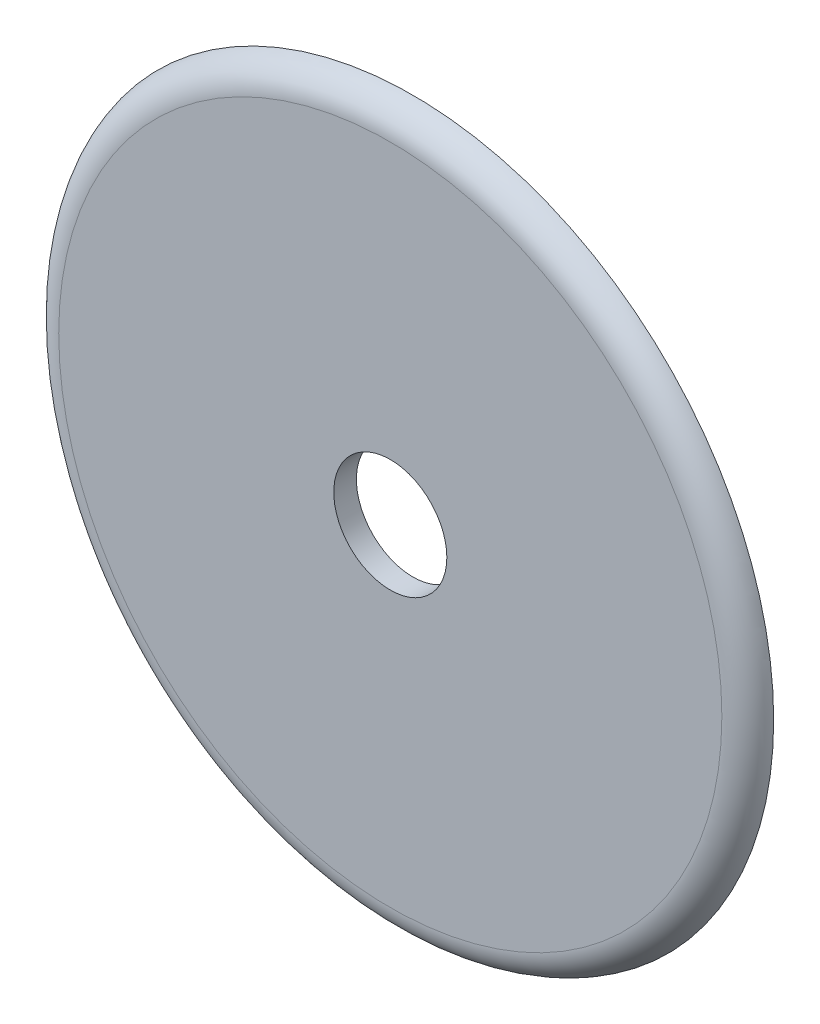
from build123d import *

# Parameters (mm, degrees)
SKETCH1_R           = 47.85
BOSS_EXTRUDE1_DEPTH = 3
SKETCH2_R           = 7.5
CUT_EXTRUDE1_DEPTH  = 6
FILLET2_R           = 4


with BuildPart() as part:
    # Sketch1 → Boss-Extrude1 (new body)
    with BuildSketch(Plane.XY):
        Circle(SKETCH1_R)
    extrude(amount=BOSS_EXTRUDE1_DEPTH)

    # Sketch2 → Cut-Extrude1 (cut)
    with BuildSketch(Plane.XY.offset(3)):
        Circle(SKETCH2_R)
    extrude(amount=-CUT_EXTRUDE1_DEPTH, mode=Mode.SUBTRACT)

    # Fillet2
    # the kernel refuses this fillet: 4 mm, written as the material it takes off along each edge
    with BuildSketch(Plane(origin=(0, 0, 3), x_dir=(1, 0, 0), z_dir=(0, -1, 0))) as fillet2_piece_1:
        with BuildLine():
            CenterArc((43.977016654, -4), FILLET2_R, 14.477512186, 75.522487814)
            Line((43.977016654, 0), (43.977016654, 0.08))
            Line((43.977016654, 0.08), (47.85, 0.08))
            Line((47.85, 0.08), (47.93, 0))
            ThreePointArc((47.93, 0), (47.93, -1.5), (47.927459667, -2.98))
            Line((47.927459667, -2.98), (47.85, -3))
        make_face()
    revolve(axis=Axis((0, 0, 3), (0, 0, 1)), mode=Mode.SUBTRACT)


solid = part.part
